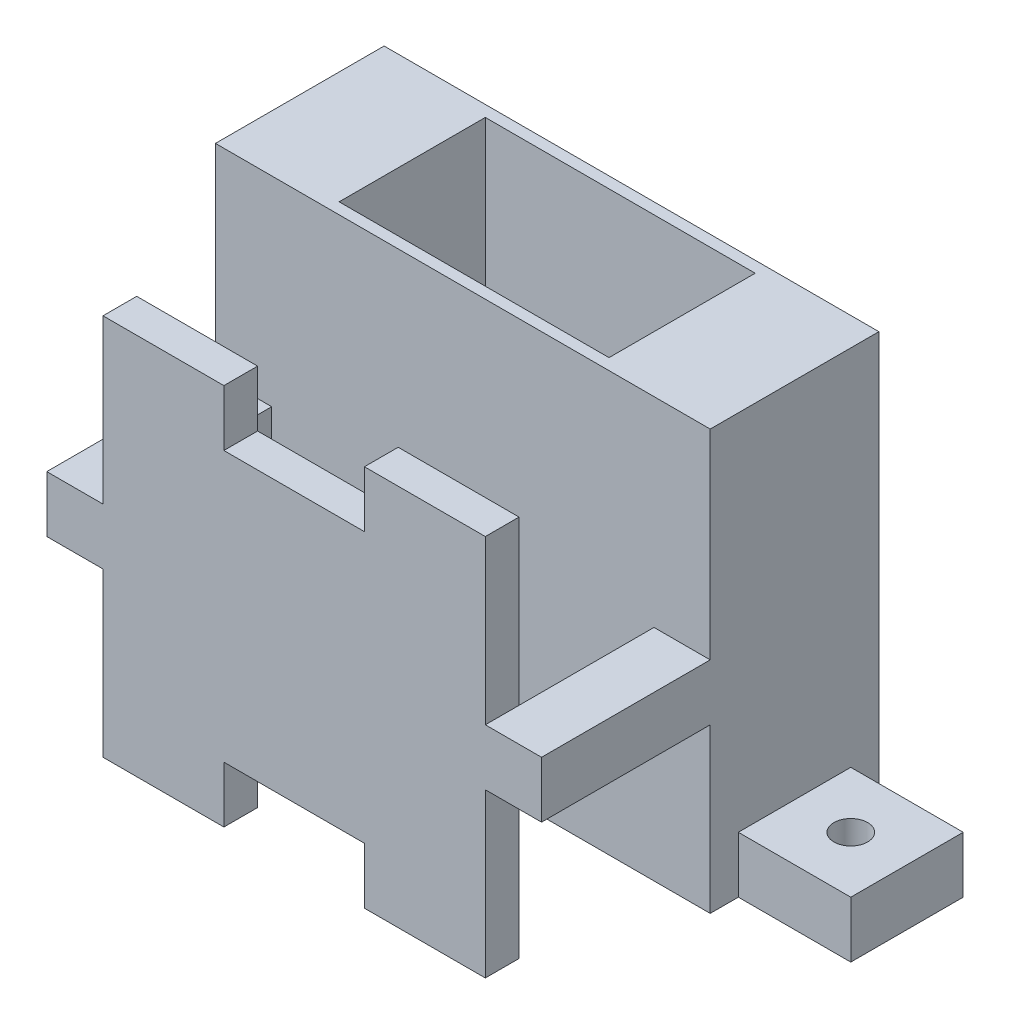
from build123d import *

# Parameters (mm, degrees)
SKETCH1_W           = 34
SKETCH1_H           = 34
BOSS_EXTRUDE1_DEPTH = 3
SKETCH2_W           = 12.5
SKETCH2_H           = 5
CUT_EXTRUDE1_DEPTH  = 49.176757882
BOSS_EXTRUDE2_DEPTH = 5
SKETCH33_W          = 15
SKETCH33_H          = 5
BOSS_EXTRUDE4_DEPTH = 5
BOSS_EXTRUDE6_DEPTH = 15
SKETCH36_W          = 24
SKETCH36_H          = 13
CUT_EXTRUDE2_DEPTH  = 19.5
SKETCH38_W          = 10
SKETCH38_H          = 10
BOSS_EXTRUDE7_DEPTH = 5
SKETCH39_R          = 1.5
CUT_EXTRUDE3_DEPTH  = 65.602833129


with BuildPart() as part:
    # Sketch1 → Boss-Extrude1 (new body)
    with BuildSketch(Plane.XY):
        with Locations((17, -17)):
            Rectangle(SKETCH1_W, SKETCH1_H)
    extrude(amount=BOSS_EXTRUDE1_DEPTH)

    # Sketch2 → Cut-Extrude1 (cut, through all)
    with BuildSketch(Plane(origin=(0, 0, 0), x_dir=(-1, 0, 0), z_dir=(0, 0, -1))):
        with Locations((-17, -2.5)):
            Rectangle(SKETCH2_W, SKETCH2_H)
        with Locations((-17, -31.5)):
            Rectangle(SKETCH2_W, SKETCH2_H)
    extrude(amount=-CUT_EXTRUDE1_DEPTH, mode=Mode.SUBTRACT)

    # Sketch25 → Boss-Extrude2 (add)
    with BuildSketch(Plane(origin=(34, 0, 0), x_dir=(0, 0, -1), z_dir=(1, 0, 0))):
        Polygon((-3, -17), (-3, -14.5), (12, -14.5), (12, -19.5), (-3, -19.5), align=None)
    extrude(amount=BOSS_EXTRUDE2_DEPTH)

    # Sketch33 → Boss-Extrude4 (add)
    with BuildSketch(Plane.ZY):
        with Locations((-4.5, -17)):
            Rectangle(SKETCH33_W, SKETCH33_H)
    extrude(amount=BOSS_EXTRUDE4_DEPTH)

    # Sketch35 → Boss-Extrude6 (add)
    with BuildSketch(Plane(origin=(0, 0, -12), x_dir=(-1, 0, 0), z_dir=(0, 0, -1))):
        Polygon((-39, -17), (-39, 3.277699473), (5, 3.277699473), (5, -17), (5, -34.025954319), (-39, -34.025954319), align=None)
    extrude(amount=BOSS_EXTRUDE6_DEPTH)

    # Sketch36 → Cut-Extrude2 (cut)
    with BuildSketch(Plane(origin=(0, 3.277699473, 0), x_dir=(1, 0, 0), z_dir=(0, 1, 0))):
        with Locations((17, 19.5)):
            Rectangle(SKETCH36_W, SKETCH36_H)
    extrude(amount=-CUT_EXTRUDE2_DEPTH, mode=Mode.SUBTRACT)

    # Sketch38 → Boss-Extrude7 (add)
    with BuildSketch(Plane(origin=(0, -34.025954319, 0), x_dir=(-1, 0, 0), z_dir=(0, -1, 0))):
        with Locations((-44, 19.5)):
            Rectangle(SKETCH38_W, SKETCH38_H)
        with Locations((10, 19.5)):
            Rectangle(SKETCH38_W, SKETCH38_H)
    extrude(amount=-BOSS_EXTRUDE7_DEPTH)

    # Sketch39 → Cut-Extrude3 (cut, through all)
    with BuildSketch(Plane(origin=(0, -29.025954319, 0), x_dir=(1, 0, 0), z_dir=(0, 1, 0))):
        with Locations((-10, 19.5)):
            Circle(SKETCH39_R)
        with Locations((44, 19.5)):
            Circle(SKETCH39_R)
    extrude(amount=-CUT_EXTRUDE3_DEPTH, mode=Mode.SUBTRACT)


solid = part.part
